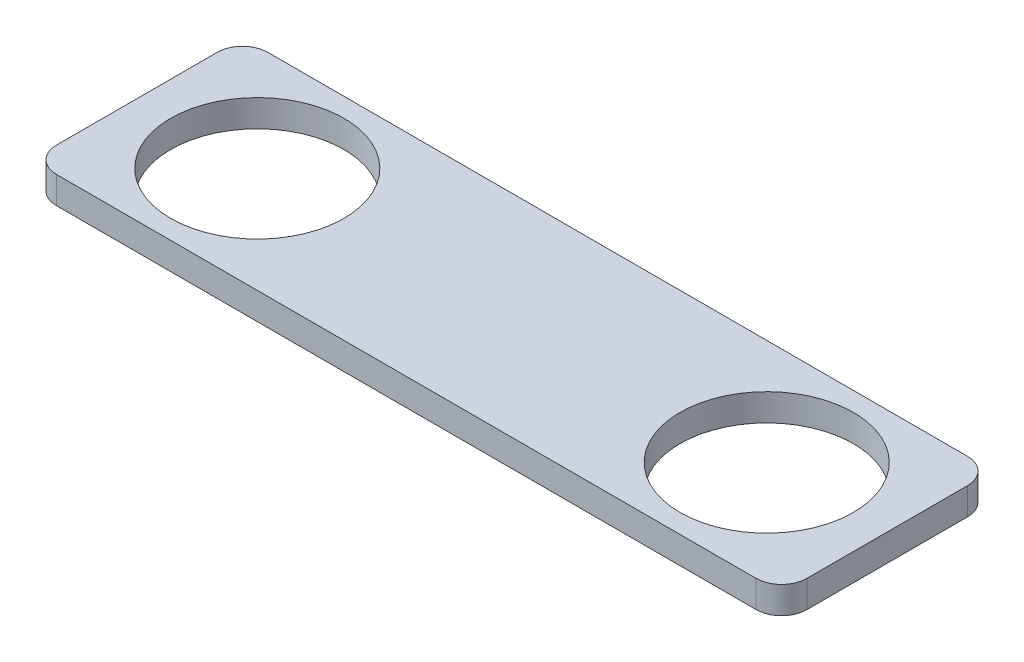
from build123d import *

# Parameters (mm, degrees)
SKETCH1_W           = 88.736
SKETCH1_H           = 25
SKETCH1_R           = 10.25
BOSS_EXTRUDE1_DEPTH = 3.2
FILLET1_R           = 3


with BuildPart() as part:
    # Sketch1 → Boss-Extrude1 (new body)
    with BuildSketch(Plane(origin=(0, 0, 0), x_dir=(1, 0, 0), z_dir=(0, 1, 0))):
        Rectangle(SKETCH1_W, SKETCH1_H)
        with Locations(Location((30.118, 0, 0), (0, 0, 270))):
            Circle(SKETCH1_R, mode=Mode.SUBTRACT)
        with Locations(Location((-30.118, 0, 0), (0, 0, 270))):
            Circle(SKETCH1_R, mode=Mode.SUBTRACT)
    extrude(amount=BOSS_EXTRUDE1_DEPTH)

    # Fillet1
    fillet1_edges = [part.edges().sort_by_distance(p)[0] for p in [
        (44.368, 1.6, -12.5),
        (44.368, 1.6, 12.5),
        (-44.368, 1.6, 12.5),
        (-44.368, 1.6, -12.5),
    ]]
    fillet(fillet1_edges, radius=FILLET1_R)


solid = part.part
